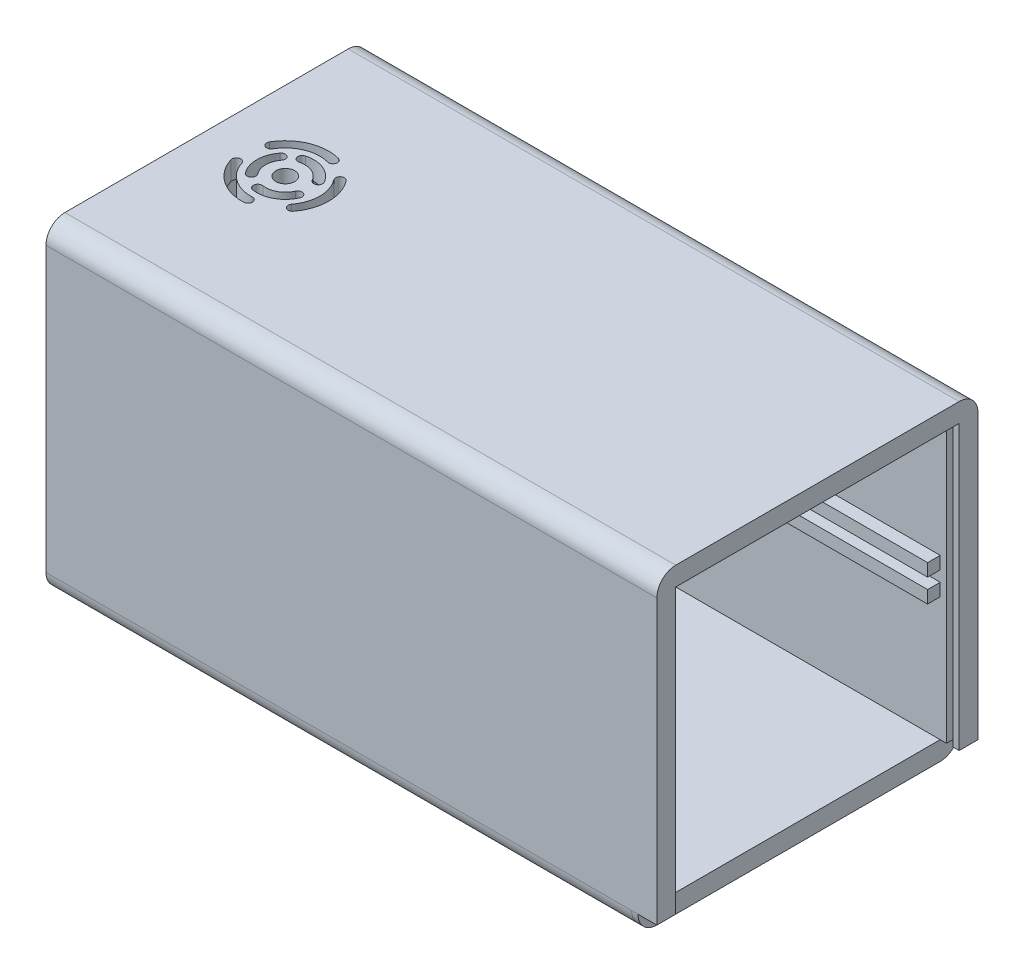
from build123d import *

# Parameters (mm, degrees)
SKETCH1_W               = 94
SKETCH1_H               = 49
BOSS_EXTRUDE1_DEPTH     = 47
SKETCH3_W               = 90
SKETCH3_H               = 45
CUT_EXTRUDE1_DEPTH      = 45
SKETCH4_W               = 49
SKETCH4_H               = 47
CUT_EXTRUDE2_DEPTH      = 2
SKETCH5_W               = 45
SKETCH5_H               = 2
BOSS_EXTRUDE2_DEPTH     = 2
SKETCH6_W               = 90
SKETCH6_H               = 2
BOSS_EXTRUDE3_DEPTH     = 2
SKETCH7_W               = 92
SKETCH7_H               = 2
BOSS_EXTRUDE4_DEPTH     = 2
SKETCH8_W               = 92
SKETCH8_H               = 2
BOSS_EXTRUDE5_DEPTH     = 2
BOSS_EXTRUDE6_DEPTH     = 2
FILLET5_R               = 3
CUT_EXTRUDE3_DEPTH      = 1
SKETCH13_W              = 92
SKETCH13_H              = 49
BOSS_EXTRUDE7_DEPTH     = 3
FILLET7_R               = 3
SKETCH14_W              = 9
SKETCH14_H              = 5.086357456
CUT_EXTRUDE4_DEPTH      = 8
SKETCH24_W              = 1.177367679
SKETCH24_H              = 45
BOSS_EXTRUDE9_DEPTH     = 2
BOSS_EXTRUDE10_DEPTH    = 1
FILLET9_R               = 3
SKETCH26_W              = 1
SKETCH26_H              = 1
CUT_EXTRUDE10_DEPTH     = 45
SKETCH15_W              = 82
SKETCH15_H              = 1
CUT_EXTRUDE5_DEPTH      = 1
SKETCH16_W              = 64
SKETCH16_H              = 1
SKETCH16_W_2            = 18
CUT_EXTRUDE6_DEPTH      = 1
SKETCH17_W              = 3.897080767
SKETCH17_H              = 1
SKETCH17_W_2            = 0.189276689
CUT_EXTRUDE7_DEPTH      = 1
SKETCH18_W              = 4.086357456
SKETCH18_H              = 1
CUT_EXTRUDE8_DEPTH      = 1
CUT_EXTRUDE9_DEPTH      = 1
BOSS_EXTRUDE11_DEPTH    = 14
SKETCH28_W              = 1
SKETCH28_H              = 45
BOSS_EXTRUDE12_DEPTH    = 1
SKETCH30_W              = 45
SKETCH30_H              = 45
CUT_EXTRUDE11_DEPTH     = 93
SKETCH31_W              = 46
SKETCH31_H              = 2
SKETCH31_W_2            = 91
SKETCH31_W_3            = 45
BOSS_EXTRUDE13_DEPTH    = 2
SKETCH32_W              = 95
SKETCH32_H              = 2
BOSS_EXTRUDE14_DEPTH    = 2
SKETCH34_W              = 45
SKETCH34_H              = 45
CUT_EXTRUDE14_DEPTH     = 93
SKETCH35_W              = 46
SKETCH35_H              = 2
SKETCH35_W_2            = 91
SKETCH35_W_3            = 45
BOSS_EXTRUDE15_DEPTH    = 2
SKETCH36_W              = 93
SKETCH36_H              = 2
BOSS_EXTRUDE16_DEPTH    = 2
SKETCH41_R              = 1.5
SKETCH41_R_2            = 1
SKETCH41_R_3            = 0.5
CUT_EXTRUDE15_DEPTH     = 3
BOSS_EXTRUDE17_DEPTH    = 1
SKETCH43_W              = 1
SKETCH43_H              = 1
BOSS_EXTRUDE18_DEPTH    = 45
SKETCH44_W              = 1
SKETCH44_H              = 1
BOSS_EXTRUDE19_DEPTH    = 45
SKETCH45_W              = 1
SKETCH45_H              = 1
CUT_EXTRUDE16_DEPTH     = 45
SKETCH46_W              = 1
SKETCH46_H              = 1
CUT_EXTRUDE17_DEPTH     = 45
BOSS_EXTRUDE20_DEPTH    = 97
BOSS_EXTRUDE21_DEPTH    = 1
SKETCH49_W              = 10
SKETCH49_H              = 3
BOSS_EXTRUDE22_DEPTH    = 93
FILLET10_R              = 3
SKETCH50_W              = 63.688215056
SKETCH50_H              = 6.387440079
CUT_EXTRUDE22_DEPTH     = 4
SKETCH51_R              = 1.5
SKETCH51_R_2            = 1
SKETCH51_R_3            = 0.5
CUT_EXTRUDE23_DEPTH     = 4
SKETCH52_W              = 4.691338673
SKETCH52_H              = 3.113312294
BOSS_EXTRUDE24_DEPTH    = 4
CUT_EXTRUDE24_DEPTH     = 91
CUT_EXTRUDE26_START     = -45
CUT_EXTRUDE26_OUTLINE_W = 2
CUT_EXTRUDE26_OUTLINE_H = 2
CUT_EXTRUDE26_DEPTH     = 91
SKETCH55_W              = 2
SKETCH55_H              = 2
BOSS_EXTRUDE25_DEPTH    = 91
SKETCH56_W              = 8.630272554
SKETCH56_H              = 5.114235588
CUT_EXTRUDE27_DEPTH     = 63
SKETCH57_W              = 1
SKETCH57_H              = 1
CUT_EXTRUDE28_DEPTH     = 45
SKETCH58_W              = 2
SKETCH58_H              = 0.05
BOSS_EXTRUDE27_DEPTH    = 91
SKETCH60_W              = 2
SKETCH60_H              = 0.05
CUT_EXTRUDE29_DEPTH     = 91
SKETCH62_W              = 82
SKETCH62_H              = 1
CUT_EXTRUDE30_DEPTH     = 10
SKETCH63_W              = 82
SKETCH63_H              = 1
BOSS_EXTRUDE28_DEPTH    = 3
SKETCH64_W              = 2
SKETCH64_H              = 2
BOSS_EXTRUDE29_DEPTH    = 90
SKETCH66_W              = 1.5
SKETCH66_H              = 1
CUT_EXTRUDE31_DEPTH     = 82
SKETCH67_W              = 25.589356111
SKETCH67_H              = 3
BOSS_EXTRUDE30_DEPTH    = 82
SKETCH69_W              = 51
SKETCH69_H              = 3
BOSS_EXTRUDE31_DEPTH    = 1
FILLET11_R              = 3


# Read off the part's stored shape, not the designer's step: Cut-Extrude26
with BuildPart() as part:
    # Sketch1 → Boss-Extrude1 (new body)
    with BuildSketch(Plane(origin=(0, 0, 0), x_dir=(1, 0, 0), z_dir=(0, 1, 0))):
        Rectangle(SKETCH1_W, SKETCH1_H)
    extrude(amount=-BOSS_EXTRUDE1_DEPTH)

    # Sketch3 → Cut-Extrude1 (cut)
    with BuildSketch(Plane(origin=(0, -47, 0), x_dir=(-1, 0, 0), z_dir=(0, -1, 0))):
        Rectangle(SKETCH3_W, SKETCH3_H)
    extrude(amount=-CUT_EXTRUDE1_DEPTH, mode=Mode.SUBTRACT)

    # Sketch4 → Cut-Extrude2 (cut)
    with BuildSketch(Plane(origin=(47, 0, 0), x_dir=(0, 0, -1), z_dir=(1, 0, 0))):
        with Locations((0, -23.5)):
            Rectangle(SKETCH4_W, SKETCH4_H)
    extrude(amount=-CUT_EXTRUDE2_DEPTH, mode=Mode.SUBTRACT)

    # Sketch5 → Boss-Extrude2 (add)
    with BuildSketch(Plane(origin=(0, 0, 22.5), x_dir=(-1, 0, 0), z_dir=(0, 0, -1))):
        with Locations((-22.5, -21)):
            Rectangle(SKETCH5_W, SKETCH5_H)
        with Locations((22.5, -21)):
            Rectangle(SKETCH5_W, SKETCH5_H)
    extrude(amount=BOSS_EXTRUDE2_DEPTH)

    # Sketch6 → Boss-Extrude3 (add)
    with BuildSketch(Plane.XY.offset(-22.5)):
        with Locations((0, -21)):
            Rectangle(SKETCH6_W, SKETCH6_H)
    extrude(amount=BOSS_EXTRUDE3_DEPTH)

    # Sketch7 → Boss-Extrude4 (add)
    with BuildSketch(Plane(origin=(0, 0, 22.5), x_dir=(-1, 0, 0), z_dir=(0, 0, -1))):
        with Locations((1, -24.6)):
            Rectangle(SKETCH7_W, SKETCH7_H)
    extrude(amount=BOSS_EXTRUDE4_DEPTH)

    # Sketch8 → Boss-Extrude5 (add)
    with BuildSketch(Plane.XY.offset(-22.5)):
        with Locations((-1, -24.6)):
            Rectangle(SKETCH8_W, SKETCH8_H)
    extrude(amount=BOSS_EXTRUDE5_DEPTH)

    # Sketch9 → Boss-Extrude6 (add)
    with BuildSketch(Plane(origin=(45, 0, 0), x_dir=(0, 0, -1), z_dir=(1, 0, 0))):
        Polygon((-24.5, -2), (-24.5, -47), (-22.5, -47), (-22.5, -2), (22.5, -2), (22.5, -47), (24.5, -47), (24.5, 0), (-22.5, 0), (-24.5, 0), align=None)
    extrude(amount=BOSS_EXTRUDE6_DEPTH)

    # Fillet5
    fillet5_edges = [part.edges().sort_by_distance(p)[0] for p in [
        (0, 0, -24.5),
        (0, 0, 24.5),
    ]]
    fillet(fillet5_edges, radius=FILLET5_R)

    # Sketch10 → Cut-Extrude3 (cut)
    with BuildSketch(Plane.XY.offset(-22.5)):
        Polygon((45, -22), (45, -47), (46, -47), (46, -3), (46, -2), (45, -2), (45, -3), align=None)
    extrude(amount=-CUT_EXTRUDE3_DEPTH, mode=Mode.SUBTRACT)

    # Sketch13 → Boss-Extrude7 (add)
    with BuildSketch(Plane.XZ.offset(47)):
        with Locations((-1, 0)):
            Rectangle(SKETCH13_W, SKETCH13_H)
    extrude(amount=BOSS_EXTRUDE7_DEPTH)

    # Fillet7
    fillet7_edges = [part.edges().sort_by_distance(p)[0] for p in [
        (-1, -50, -24.5),
        (-1, -50, 24.5),
    ]]
    fillet(fillet7_edges, radius=FILLET7_R)

    # Sketch14 → Cut-Extrude4 (cut)
    with BuildSketch(Plane.XZ.offset(50)):
        Polygon((-37, -9.5), (45, -9.5), (45, 11.5), (36, 11.5), (27, 11.5), (-37, 11.5), align=None)
        with Locations((31.5, 14.043178728)):
            Rectangle(SKETCH14_W, SKETCH14_H)
    extrude(amount=-CUT_EXTRUDE4_DEPTH, mode=Mode.SUBTRACT)

    # Sketch24 → Boss-Extrude9 (add)
    with BuildSketch(Plane(origin=(45, 0, 0), x_dir=(0, 0, -1), z_dir=(1, 0, 0))):
        with Locations((23.088683839, -24.5)):
            Rectangle(SKETCH24_W, SKETCH24_H)
    extrude(amount=BOSS_EXTRUDE9_DEPTH)

    # Sketch25 → Boss-Extrude10 (add)
    with BuildSketch(Plane(origin=(47, 0, 0), x_dir=(0, 0, -1), z_dir=(1, 0, 0))):
        Polygon((-24.5, -47), (-22.5, -47), (-22.5, -2), (22.5, -2), (22.5, -47), (24.5, -47), (24.5, 0), (-24.5, 0), align=None)
    extrude(amount=BOSS_EXTRUDE10_DEPTH)

    # Fillet9
    fillet9_edges = [part.edges().sort_by_distance(p)[0] for p in [
        (47.5, 0, 24.5),
        (47.5, 0, -24.5),
    ]]
    fillet(fillet9_edges, radius=FILLET9_R)

    # Sketch26 → Cut-Extrude10 (cut)
    with BuildSketch(Plane.XZ.offset(47)):
        with Locations((46.5, 23)):
            Rectangle(SKETCH26_W, SKETCH26_H)
        with Locations((46.5, -23)):
            Rectangle(SKETCH26_W, SKETCH26_H)
    extrude(amount=-CUT_EXTRUDE10_DEPTH, mode=Mode.SUBTRACT)

    # Sketch15 → Cut-Extrude5 (cut)
    with BuildSketch(Plane.XY.offset(-9.5)):
        with Locations((4, -48.5)):
            Rectangle(SKETCH15_W, SKETCH15_H)
    extrude(amount=-CUT_EXTRUDE5_DEPTH, mode=Mode.SUBTRACT)

    # Sketch16 → Cut-Extrude6 (cut)
    with BuildSketch(Plane(origin=(0, 0, 11.5), x_dir=(-1, 0, 0), z_dir=(0, 0, -1))):
        with Locations((5, -48.5)):
            Rectangle(SKETCH16_W, SKETCH16_H)
        with Locations((-36, -48.5)):
            Rectangle(SKETCH16_W_2, SKETCH16_H)
    extrude(amount=-CUT_EXTRUDE6_DEPTH, mode=Mode.SUBTRACT)

    # Sketch17 → Cut-Extrude7 (cut)
    with BuildSketch(Plane(origin=(27, 0, 0), x_dir=(0, 0, -1), z_dir=(1, 0, 0))):
        with Locations((-14.448540384, -48.5)):
            Rectangle(SKETCH17_W, SKETCH17_H)
        with Locations((-16.491719112, -48.5)):
            Rectangle(SKETCH17_W_2, SKETCH17_H)
    extrude(amount=-CUT_EXTRUDE7_DEPTH, mode=Mode.SUBTRACT)

    # Sketch18 → Cut-Extrude8 (cut)
    with BuildSketch(Plane.ZY.offset(-36)):
        with Locations((14.543178728, -48.5)):
            Rectangle(SKETCH18_W, SKETCH18_H)
    extrude(amount=-CUT_EXTRUDE8_DEPTH, mode=Mode.SUBTRACT)

    # Sketch11 → Cut-Extrude9 (cut)
    with BuildSketch(Plane(origin=(0, 0, 22.5), x_dir=(-1, 0, 0), z_dir=(0, 0, -1))):
        Polygon((-45, -22), (-45, -47), (-46, -47), (-46, -2), (-45, -2), align=None)
    extrude(amount=-CUT_EXTRUDE9_DEPTH, mode=Mode.SUBTRACT)

    # Sketch27 → Boss-Extrude11 (add)
    with BuildSketch(Plane(origin=(26, 0, 0), x_dir=(0, 0, -1), z_dir=(1, 0, 0))):
        Polygon((-12.5, -49), (-11.5, -49), (-11.5, -50), (-16.586357456, -50), (-17.508696805, -50), (-17.508696805, -47), (-11.5, -47), (-11.5, -48), (-12.5, -48), align=None)
    extrude(amount=BOSS_EXTRUDE11_DEPTH)

    # Sketch28 → Boss-Extrude12 (add)
    with BuildSketch(Plane(origin=(45, 0, 0), x_dir=(0, 0, -1), z_dir=(1, 0, 0))):
        with Locations((-23, -24.5)):
            Rectangle(SKETCH28_W, SKETCH28_H)
    extrude(amount=BOSS_EXTRUDE12_DEPTH)

    # Sketch30 → Cut-Extrude11 (cut)
    with BuildSketch(Plane(origin=(48, 0, 0), x_dir=(0, 0, -1), z_dir=(1, 0, 0))):
        with Locations((0, -24.5)):
            Rectangle(SKETCH30_W, SKETCH30_H)
    extrude(amount=-CUT_EXTRUDE11_DEPTH, mode=Mode.SUBTRACT)

    # Sketch31 → Boss-Extrude13 (add)
    with BuildSketch(Plane(origin=(0, 0, 22.5), x_dir=(-1, 0, 0), z_dir=(0, 0, -1))):
        with Locations((-23, -20.6)):
            Rectangle(SKETCH31_W, SKETCH31_H)
        with Locations((-0.5, -24.4)):
            Rectangle(SKETCH31_W_2, SKETCH31_H)
        with Locations((22.5, -20.6)):
            Rectangle(SKETCH31_W_3, SKETCH31_H)
    extrude(amount=BOSS_EXTRUDE13_DEPTH)

    # Sketch32 → Boss-Extrude14 (add)
    with BuildSketch(Plane.XY.offset(-22.5)):
        with Locations((0.5, -20.6)):
            Rectangle(SKETCH32_W, SKETCH32_H)
        with Locations((0.5, -24.4)):
            Rectangle(SKETCH32_W, SKETCH32_H)
    extrude(amount=BOSS_EXTRUDE14_DEPTH)

    # Sketch34 → Cut-Extrude14 (cut)
    with BuildSketch(Plane(origin=(48, 0, 0), x_dir=(0, 0, -1), z_dir=(1, 0, 0))):
        with Locations((0, -24.5)):
            Rectangle(SKETCH34_W, SKETCH34_H)
    extrude(amount=-CUT_EXTRUDE14_DEPTH, mode=Mode.SUBTRACT)

    # Sketch35 → Boss-Extrude15 (add)
    with BuildSketch(Plane(origin=(0, 0, 22.5), x_dir=(-1, 0, 0), z_dir=(0, 0, -1))):
        with Locations((-23, -20.6)):
            Rectangle(SKETCH35_W, SKETCH35_H)
        with Locations((-0.5, -24.4)):
            Rectangle(SKETCH35_W_2, SKETCH35_H)
        with Locations((22.5, -20.6)):
            Rectangle(SKETCH35_W_3, SKETCH35_H)
    extrude(amount=BOSS_EXTRUDE15_DEPTH)

    # Sketch36 → Boss-Extrude16 (add)
    with BuildSketch(Plane.XY.offset(-22.5)):
        with Locations((-0.5, -20.6)):
            Rectangle(SKETCH36_W, SKETCH36_H)
        with Locations((-0.5, -24.4)):
            Rectangle(SKETCH36_W, SKETCH36_H)
    extrude(amount=BOSS_EXTRUDE16_DEPTH)

    # Sketch41 → Cut-Extrude15 (cut)
    # profile 1 of 9: a face of its own
    with BuildSketch(Plane(origin=(0, 0, 0), x_dir=(1, 0, 0), z_dir=(0, 1, 0))):
        with BuildLine():
            ThreePointArc((-33.685162112, 6.650461434), (-38.123416229, 6.374947932), (-41.470067452, 3.446820051))
            ThreePointArc((-41.470067452, 3.446820051), (-41.213849669, 2.490602268), (-40.257631887, 2.746820051))
            ThreePointArc((-40.257631887, 2.746820051), (-37.590637803, 5.080286915), (-34.053729807, 5.299847553))
            ThreePointArc((-34.053729807, 5.299847553), (-33.194139019, 5.790870646), (-33.685162112, 6.650461434))
        make_face()
    # profile 2 of 9: a face of its own
    with BuildSketch(Plane(origin=(0, 0, 0), x_dir=(1, 0, 0), z_dir=(0, 1, 0))):
        with BuildLine():
            ThreePointArc((-31.578791687, 2.263910675), (-31.83500947, 1.307692892), (-32.791227253, 1.563910675))
            ThreePointArc((-32.791227253, 1.563910675), (-34.30303459, 2.889730126), (-36.309539735, 3.021243422))
            ThreePointArc((-36.309539735, 3.021243422), (-37.166861145, 3.516218168), (-36.671886398, 4.373539578))
            ThreePointArc((-36.671886398, 4.373539578), (-33.767277785, 4.183161472), (-31.578791687, 2.263910675))
        make_face()
    # profile 3 of 9: a face of its own
    with BuildSketch(Plane(origin=(0, 0, 0), x_dir=(1, 0, 0), z_dir=(0, 1, 0))):
        with BuildLine():
            ThreePointArc((-30.030907599, -4.196582199), (-28.606359899, 0), (-30.030907599, 4.196582199))
            ThreePointArc((-30.030907599, 4.196582199), (-31.012387938, 4.325796537), (-31.141602275, 3.344316198))
            ThreePointArc((-31.141602275, 3.344316198), (-30.006359899, 0), (-31.141602275, -3.344316198))
            ThreePointArc((-31.141602275, -3.344316198), (-31.012387938, -4.325796537), (-30.030907599, -4.196582199))
        make_face()
    # profile 4 of 9: a face of its own
    with BuildSketch(Plane(origin=(0, 0, 0), x_dir=(1, 0, 0), z_dir=(0, 1, 0))):
        with BuildLine():
            ThreePointArc((-39.092162192, 2.756362995), (-40.02782135, 0), (-39.092162192, -2.756362995))
            ThreePointArc((-39.092162192, -2.756362995), (-38.110681853, -2.885577333), (-37.981467516, -1.904096994))
            ThreePointArc((-37.981467516, -1.904096994), (-38.62782135, 0), (-37.981467516, 1.904096994))
            ThreePointArc((-37.981467516, 1.904096994), (-38.110681853, 2.885577333), (-39.092162192, 2.756362995))
        make_face()
    # profile 5 of 9: a face of its own
    with BuildSketch(Plane(origin=(0, 0, 0), x_dir=(1, 0, 0), z_dir=(0, 1, 0))):
        with BuildLine():
            ThreePointArc((-42.074581417, -2.072957558), (-41.617473611, -1.194861633), (-40.739377686, -1.651969439))
            ThreePointArc((-40.739377686, -1.651969439), (-38.640656678, -4.507366991), (-35.235109144, -5.487250167))
            ThreePointArc((-35.235109144, -5.487250167), (-34.502170938, -6.15268355), (-35.167604321, -6.885621755))
            ThreePointArc((-35.167604321, -6.885621755), (-39.441022059, -5.656025016), (-42.074581417, -2.072957558))
        make_face()
    # profile 6 of 9: a face of its own
    with BuildSketch(Plane(origin=(0, 0, 0), x_dir=(1, 0, 0), z_dir=(0, 1, 0))):
        with BuildLine():
            ThreePointArc((-36.188787516, -4.475124348), (-33.322168783, -3.969662122), (-31.355633143, -1.823565061))
            ThreePointArc((-31.355633143, -1.823565061), (-31.714428496, -0.900924343), (-32.637069214, -1.259719695))
            ThreePointArc((-32.637069214, -1.259719695), (-33.99555306, -2.742244664), (-35.975814775, -3.091418234))
            ThreePointArc((-35.975814775, -3.091418234), (-36.774154203, -3.676784921), (-36.188787516, -4.475124348))
        make_face()
    # profile 7 of 9: a face of its own
    with BuildSketch(Plane(origin=(0, 0, 0), x_dir=(1, 0, 0), z_dir=(0, 1, 0))):
        with Locations(Location((-35.5, 0, 0), (0, 0, 270))):
            Circle(SKETCH41_R)
        with Locations((-35.5, 0)):
            Circle(SKETCH41_R_2, mode=Mode.SUBTRACT)
    # profile 8 of 9: a face of its own
    with BuildSketch(Plane(origin=(0, 0, 0), x_dir=(1, 0, 0), z_dir=(0, 1, 0))):
        with Locations((-35.5, 0)):
            Circle(SKETCH41_R_2)
        with Locations((-35.5, 0)):
            Circle(SKETCH41_R_3, mode=Mode.SUBTRACT)
    # profile 9 of 9: a face of its own
    with BuildSketch(Plane(origin=(0, 0, 0), x_dir=(1, 0, 0), z_dir=(0, 1, 0))):
        with Locations((-35.5, 0)):
            Circle(SKETCH41_R_3)
    extrude(amount=-CUT_EXTRUDE15_DEPTH, mode=Mode.SUBTRACT)

    # Sketch42 → Boss-Extrude17 (add)
    with BuildSketch(Plane(origin=(48, 0, 0), x_dir=(0, 0, -1), z_dir=(1, 0, 0))):
        Polygon((-24.5, -47), (-24.5, 0), (24.5, 0), (24.5, -47), (22.5, -47), (22.5, -2), (-22.5, -2), (-22.5, -47), align=None)
    extrude(amount=BOSS_EXTRUDE17_DEPTH)

    # Sketch43 → Boss-Extrude18 (add)
    with BuildSketch(Plane.XZ.offset(47)):
        with Locations((46.5, -23)):
            Rectangle(SKETCH43_W, SKETCH43_H)
    extrude(amount=-BOSS_EXTRUDE18_DEPTH)

    # Sketch44 → Boss-Extrude19 (add)
    with BuildSketch(Plane.XZ.offset(47)):
        with Locations((46.5, 23)):
            Rectangle(SKETCH44_W, SKETCH44_H)
    extrude(amount=-BOSS_EXTRUDE19_DEPTH)

    # Sketch45 → Cut-Extrude16 (cut)
    with BuildSketch(Plane.XZ.offset(47)):
        with Locations((47.5, -23)):
            Rectangle(SKETCH45_W, SKETCH45_H)
    extrude(amount=-CUT_EXTRUDE16_DEPTH, mode=Mode.SUBTRACT)

    # Sketch46 → Cut-Extrude17 (cut)
    with BuildSketch(Plane.XZ.offset(47)):
        with Locations((47.5, 23)):
            Rectangle(SKETCH46_W, SKETCH46_H)
    extrude(amount=-CUT_EXTRUDE17_DEPTH, mode=Mode.SUBTRACT)

    # Sketch47 → Boss-Extrude20 (add)
    with BuildSketch(Plane(origin=(49, 0, 0), x_dir=(0, 0, -1), z_dir=(1, 0, 0))):
        Polygon((-22.5, -47), (-22.5, -2), (22.5, -2), (22.5, -47), (22.5, -50), (25.5, -50), (25.5, 0), (25.5, 1), (-24.5, 1), (-25.5, 1), (-25.5, -47), (-25.5, -50), (-22.5, -50), align=None)
    extrude(amount=-BOSS_EXTRUDE20_DEPTH)

    # Sketch48 → Boss-Extrude21 (add)
    with BuildSketch(Plane.ZY.offset(47)):
        Polygon((-22.5, -50), (22.5, -50), (22.5, -2), (-22.5, -2), (-22.5, -49.828427125), align=None)
    extrude(amount=BOSS_EXTRUDE21_DEPTH)

    # Sketch49 → Boss-Extrude22 (add)
    with BuildSketch(Plane(origin=(45, 0, 0), x_dir=(0, 0, -1), z_dir=(1, 0, 0))):
        Polygon((-25.5, -50), (-16.80635026, -50), (-17, -47), (-25.5, -47), align=None)
        with Locations((20.5, -48.5)):
            Rectangle(SKETCH49_W, SKETCH49_H)
    extrude(amount=-BOSS_EXTRUDE22_DEPTH)

    # Fillet10
    fillet10_edges = [part.edges().sort_by_distance(p)[0] for p in [
        (0.5, 1, -25.5),
        (0.5, 1, 25.5),
        (0.5, -50, 25.5),
        (0.5, -50, -25.5),
    ]]
    fillet(fillet10_edges, radius=FILLET10_R)

    # Sketch50 → Cut-Extrude22 (cut)
    with BuildSketch(Plane(origin=(49, 0, 0), x_dir=(0, 0, -1), z_dir=(1, 0, 0))):
        with Locations((-3.014674481, -50.19372004)):
            Rectangle(SKETCH50_W, SKETCH50_H)
    extrude(amount=-CUT_EXTRUDE22_DEPTH, mode=Mode.SUBTRACT)

    # Sketch51 → Cut-Extrude23 (cut)
    # profile 1 of 9: a face of its own
    with BuildSketch(Plane(origin=(0, 1, 0), x_dir=(1, 0, 0), z_dir=(0, 1, 0))):
        with BuildLine():
            ThreePointArc((-33.715794652, 6.658745011), (-38.138081855, 6.368892994), (-41.470067452, 3.446820051))
            ThreePointArc((-41.470067452, 3.446820051), (-41.213849669, 2.490602268), (-40.257631887, 2.746820051))
            ThreePointArc((-40.257631887, 2.746820051), (-37.60232505, 5.075461648), (-34.078141315, 5.306448854))
            ThreePointArc((-34.078141315, 5.306448854), (-33.220819905, 5.801423601), (-33.715794652, 6.658745011))
        make_face()
    # profile 2 of 9: a face of its own
    with BuildSketch(Plane(origin=(0, 1, 0), x_dir=(1, 0, 0), z_dir=(0, 1, 0))):
        with BuildLine():
            ThreePointArc((-42.074581417, -2.072957558), (-41.617473611, -1.194861633), (-40.739377686, -1.651969439))
            ThreePointArc((-40.739377686, -1.651969439), (-38.651022512, -4.500126519), (-35.260370784, -5.488411373))
            ThreePointArc((-35.260370784, -5.488411373), (-34.530503458, -6.157211557), (-35.199303642, -6.887078883))
            ThreePointArc((-35.199303642, -6.887078883), (-39.454029523, -5.646939381), (-42.074581417, -2.072957558))
        make_face()
    # profile 3 of 9: a face of its own
    with BuildSketch(Plane(origin=(0, 1, 0), x_dir=(1, 0, 0), z_dir=(0, 1, 0))):
        with BuildLine():
            ThreePointArc((-39.092162192, 2.756362995), (-40.02782135, 0), (-39.092162192, -2.756362995))
            ThreePointArc((-39.092162192, -2.756362995), (-38.110681853, -2.885577333), (-37.981467516, -1.904096994))
            ThreePointArc((-37.981467516, -1.904096994), (-38.62782135, 0), (-37.981467516, 1.904096994))
            ThreePointArc((-37.981467516, 1.904096994), (-38.110681853, 2.885577333), (-39.092162192, 2.756362995))
        make_face()
    # profile 4 of 9: a face of its own
    with BuildSketch(Plane(origin=(0, 1, 0), x_dir=(1, 0, 0), z_dir=(0, 1, 0))):
        with BuildLine():
            ThreePointArc((-36.188787516, -4.475124348), (-33.322168783, -3.969662122), (-31.355633143, -1.823565061))
            ThreePointArc((-31.355633143, -1.823565061), (-31.714428496, -0.900924343), (-32.637069214, -1.259719695))
            ThreePointArc((-32.637069214, -1.259719695), (-33.99555306, -2.742244664), (-35.975814775, -3.091418234))
            ThreePointArc((-35.975814775, -3.091418234), (-36.774154203, -3.676784921), (-36.188787516, -4.475124348))
        make_face()
    # profile 5 of 9: a face of its own
    with BuildSketch(Plane(origin=(0, 1, 0), x_dir=(1, 0, 0), z_dir=(0, 1, 0))):
        with BuildLine():
            ThreePointArc((-30.030907599, -4.196582199), (-28.606359899, 0), (-30.030907599, 4.196582199))
            ThreePointArc((-30.030907599, 4.196582199), (-31.012387938, 4.325796537), (-31.141602275, 3.344316198))
            ThreePointArc((-31.141602275, 3.344316198), (-30.006359899, 0), (-31.141602275, -3.344316198))
            ThreePointArc((-31.141602275, -3.344316198), (-31.012387938, -4.325796537), (-30.030907599, -4.196582199))
        make_face()
    # profile 6 of 9: a face of its own
    with BuildSketch(Plane(origin=(0, 1, 0), x_dir=(1, 0, 0), z_dir=(0, 1, 0))):
        with Locations(Location((-35.5, 0, 0), (0, 0, 270))):
            Circle(SKETCH51_R)
        with Locations((-35.5, 0)):
            Circle(SKETCH51_R_2, mode=Mode.SUBTRACT)
    # profile 7 of 9: a face of its own
    with BuildSketch(Plane(origin=(0, 1, 0), x_dir=(1, 0, 0), z_dir=(0, 1, 0))):
        with Locations((-35.5, 0)):
            Circle(SKETCH51_R_2)
        with Locations((-35.5, 0)):
            Circle(SKETCH51_R_3, mode=Mode.SUBTRACT)
    # profile 8 of 9: a face of its own
    with BuildSketch(Plane(origin=(0, 1, 0), x_dir=(1, 0, 0), z_dir=(0, 1, 0))):
        with Locations((-35.5, 0)):
            Circle(SKETCH51_R_3)
    # profile 9 of 9: a face of its own
    with BuildSketch(Plane(origin=(0, 1, 0), x_dir=(1, 0, 0), z_dir=(0, 1, 0))):
        with BuildLine():
            ThreePointArc((-36.671886398, 4.373539578), (-33.767277785, 4.183161472), (-31.578791687, 2.263910675))
            ThreePointArc((-31.578791687, 2.263910675), (-31.83500947, 1.307692892), (-32.791227253, 1.563910675))
            ThreePointArc((-32.791227253, 1.563910675), (-34.30303459, 2.889730126), (-36.309539735, 3.021243422))
            ThreePointArc((-36.309539735, 3.021243422), (-37.166861145, 3.516218168), (-36.671886398, 4.373539578))
        make_face()
    extrude(amount=-CUT_EXTRUDE23_DEPTH, mode=Mode.SUBTRACT)

    # Sketch53 → Cut-Extrude24 (cut)
    with BuildSketch(Plane(origin=(46, 0, 0), x_dir=(0, 0, -1), z_dir=(1, 0, 0))):
        Polygon((22.5, -17.34806117), (-22.5, -17.34806117), (-22.5, -27.496622415), (22.5, -27.496622415), (22.5, -21.6), (20.5, -21.6), (20.5, -19.6), (22.5, -19.6), align=None)
    extrude(amount=-CUT_EXTRUDE24_DEPTH, mode=Mode.SUBTRACT)

    # Cut-Extrude26 outline → Cut-Extrude26 (cut)
    with BuildSketch(Plane.YZ.offset(CUT_EXTRUDE26_START)):
        with Locations((-20.6, -21.5)):
            Rectangle(CUT_EXTRUDE26_OUTLINE_W, CUT_EXTRUDE26_OUTLINE_H)
    extrude(amount=CUT_EXTRUDE26_DEPTH, mode=Mode.SUBTRACT)

    # Sketch55 → Boss-Extrude25 (add)
    with BuildSketch(Plane(origin=(46, 0, 0), x_dir=(0, 0, -1), z_dir=(1, 0, 0))):
        with Locations((-21.5, -22.6)):
            Rectangle(SKETCH55_W, SKETCH55_H)
        with Locations((-21.5, -26.4)):
            Rectangle(SKETCH55_W, SKETCH55_H)
        with Locations((21.5, -22.6)):
            Rectangle(SKETCH55_W, SKETCH55_H)
        with Locations((21.5, -26.4)):
            Rectangle(SKETCH55_W, SKETCH55_H)
    extrude(amount=-BOSS_EXTRUDE25_DEPTH)

    # Sketch57 → Cut-Extrude28 (cut)
    with BuildSketch(Plane.XZ.offset(47)):
        with Locations((47.5, 23)):
            Rectangle(SKETCH57_W, SKETCH57_H)
        with Locations((47.5, -23)):
            Rectangle(SKETCH57_W, SKETCH57_H)
    extrude(amount=-CUT_EXTRUDE28_DEPTH, mode=Mode.SUBTRACT)

    # Sketch58 → Boss-Extrude27 (add)
    with BuildSketch(Plane(origin=(46, 0, 0), x_dir=(0, 0, -1), z_dir=(1, 0, 0))):
        with Locations((21.5, -23.625)):
            Rectangle(SKETCH58_W, SKETCH58_H)
        with Locations((21.5, -25.375)):
            Rectangle(SKETCH58_W, SKETCH58_H)
        with Locations((-21.5, -25.375)):
            Rectangle(SKETCH58_W, SKETCH58_H)
        with Locations((-21.5, -23.625)):
            Rectangle(SKETCH58_W, SKETCH58_H)
    extrude(amount=-BOSS_EXTRUDE27_DEPTH)

    # Sketch60 → Cut-Extrude29 (cut)
    with BuildSketch(Plane(origin=(46, 0, 0), x_dir=(0, 0, -1), z_dir=(1, 0, 0))):
        with Locations((-21.5, -21.625)):
            Rectangle(SKETCH60_W, SKETCH60_H)
        with Locations((-21.5, -27.375)):
            Rectangle(SKETCH60_W, SKETCH60_H)
        with Locations((21.5, -27.375)):
            Rectangle(SKETCH60_W, SKETCH60_H)
        with Locations((21.5, -21.625)):
            Rectangle(SKETCH60_W, SKETCH60_H)
    extrude(amount=-CUT_EXTRUDE29_DEPTH, mode=Mode.SUBTRACT)

    # Sketch62 → Cut-Extrude30 (cut)
    with BuildSketch(Plane.XZ.offset(50)):
        with Locations((4, 11)):
            Rectangle(SKETCH62_W, SKETCH62_H)
        with Locations((4, -10)):
            Rectangle(SKETCH62_W, SKETCH62_H)
    extrude(amount=-CUT_EXTRUDE30_DEPTH, mode=Mode.SUBTRACT)

    # Sketch63 → Boss-Extrude28 (add)
    with BuildSketch(Plane.XZ.offset(50)):
        with Locations((4, 11)):
            Rectangle(SKETCH63_W, SKETCH63_H)
    extrude(amount=-BOSS_EXTRUDE28_DEPTH)

    # Sketch64 → Boss-Extrude29 (add)
    with BuildSketch(Plane(origin=(45, 0, 0), x_dir=(0, 0, -1), z_dir=(1, 0, 0))):
        with Locations((-12.5, -49)):
            Rectangle(SKETCH64_W, SKETCH64_H)
    extrude(amount=-BOSS_EXTRUDE29_DEPTH)

    # Sketch66 → Cut-Extrude31 (cut)
    with BuildSketch(Plane(origin=(45, 0, 0), x_dir=(0, 0, -1), z_dir=(1, 0, 0))):
        with Locations((11.25, -48.5)):
            Rectangle(SKETCH66_W, SKETCH66_H)
        with Locations((-11.25, -48.5)):
            Rectangle(SKETCH66_W, SKETCH66_H)
    extrude(amount=-CUT_EXTRUDE31_DEPTH, mode=Mode.SUBTRACT)

    # Sketch67 → Boss-Extrude30 (add)
    with BuildSketch(Plane(origin=(-37, 0, 0), x_dir=(0, 0, -1), z_dir=(1, 0, 0))):
        with Locations((0.601630629, -48.5)):
            Rectangle(SKETCH67_W, SKETCH67_H)
    extrude(amount=BOSS_EXTRUDE30_DEPTH)

    # Sketch69 → Boss-Extrude31 (add)
    with BuildSketch(Plane(origin=(45, 0, 0), x_dir=(0, 0, -1), z_dir=(1, 0, 0))):
        with Locations((0, -48.5)):
            Rectangle(SKETCH69_W, SKETCH69_H)
    extrude(amount=BOSS_EXTRUDE31_DEPTH)

    # Fillet11
    fillet11_edges = [part.edges().sort_by_distance(p)[0] for p in [
        (45.5, -50, -25.5),
        (45.5, -50, 25.5),
    ]]
    fillet(fillet11_edges, radius=FILLET11_R)


with BuildPart() as body_2:
    # Sketch52 → Boss-Extrude24 (new body)
    with BuildSketch(Plane(origin=(46, 0, 0), x_dir=(0, 0, -1), z_dir=(1, 0, 0))):
        with Locations((12.96394923, -8.248996189)):
            Rectangle(SKETCH52_W, SKETCH52_H)
    extrude(amount=-BOSS_EXTRUDE24_DEPTH)

    # Sketch56 → Cut-Extrude27 (cut)
    with BuildSketch(Plane(origin=(46, 0, 0), x_dir=(0, 0, -1), z_dir=(1, 0, 0))):
        with Locations((12.687626972, -8.31823896)):
            Rectangle(SKETCH56_W, SKETCH56_H)
    extrude(amount=-CUT_EXTRUDE27_DEPTH, mode=Mode.SUBTRACT)


solid = part.part
